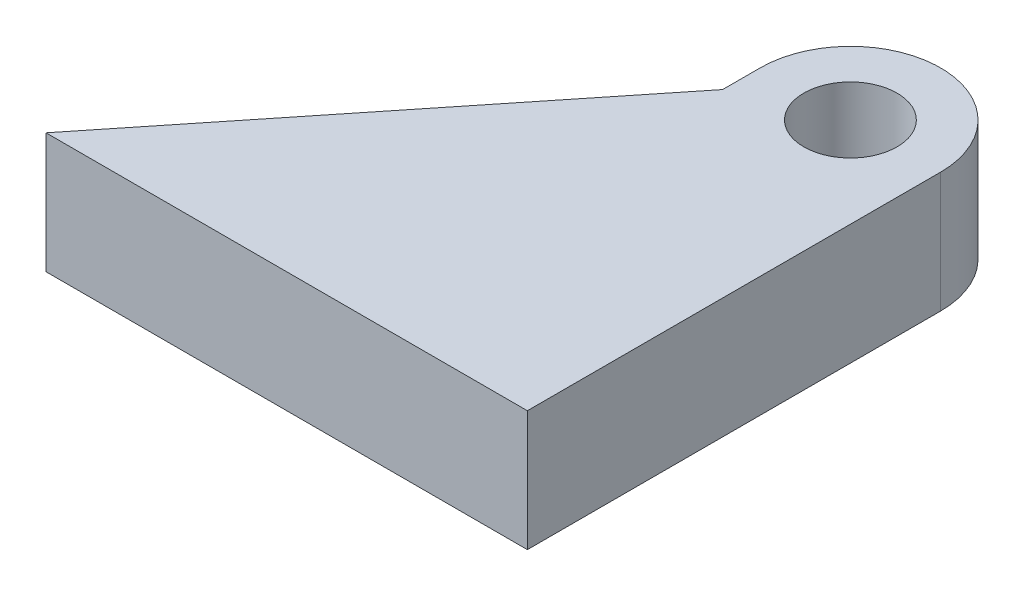
from build123d import *

# Parameters (mm, degrees)
SKETCH1_R           = 7.75
BOSS_EXTRUDE1_DEPTH = 20


with BuildPart() as part:
    # Sketch1 → Boss-Extrude1 (new body)
    with BuildSketch(Plane(origin=(0, 0, 0), x_dir=(1, 0, 0), z_dir=(0, 1, 0))):
        with BuildLine():
            Line((-15, 0), (-15.001654127, -6.242517264))
            Line((-15.001654127, -6.242517264), (-65.001652527, -68.69249853))
            Line((-65.001652527, -68.69249853), (15, -68.69249853))
            Line((15, -68.69249853), (15, 0))
            ThreePointArc((15, 0), (0, 14.996025862), (-15, 0))
        make_face()
        Circle(SKETCH1_R, mode=Mode.SUBTRACT)
    extrude(amount=BOSS_EXTRUDE1_DEPTH)


solid = part.part
